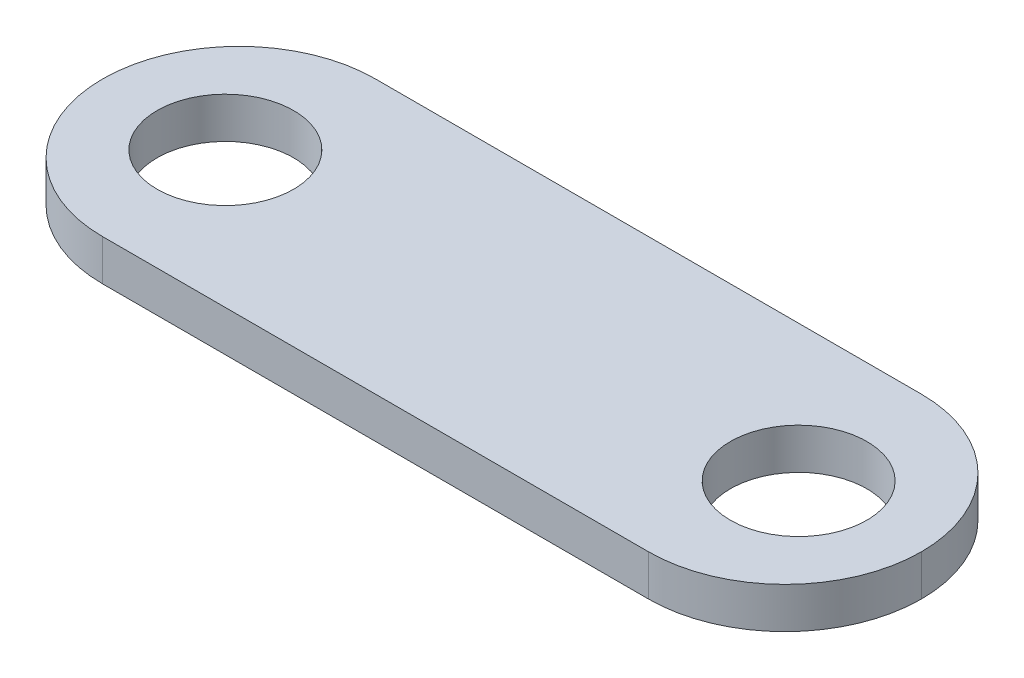
from build123d import *

# Parameters (mm, degrees)
SKETCH2_W           = 60
SKETCH2_H           = 20
BOSS_EXTRUDE1_DEPTH = 3
SKETCH3_R           = 5
CUT_EXTRUDE1_DEPTH  = 64.316664473
SKETCH4_R           = 5
CUT_EXTRUDE2_DEPTH  = 64.316664473
FILLET1_R           = 10
FILLET2_R           = 10


with BuildPart() as part:
    # Sketch2 → Boss-Extrude1 (new body)
    with BuildSketch(Plane(origin=(0, 0, 0), x_dir=(1, 0, 0), z_dir=(0, 1, 0))):
        with Locations((30, 10)):
            Rectangle(SKETCH2_W, SKETCH2_H)
    extrude(amount=BOSS_EXTRUDE1_DEPTH)

    # Sketch3 → Cut-Extrude1 (cut, through all)
    with BuildSketch(Plane(origin=(0, 3, 0), x_dir=(1, 0, 0), z_dir=(0, 1, 0))):
        with Locations(Location((9, 10, 0), (0, 0, 270))):
            Circle(SKETCH3_R)
    extrude(amount=-CUT_EXTRUDE1_DEPTH, mode=Mode.SUBTRACT)

    # Sketch4 → Cut-Extrude2 (cut, through all)
    with BuildSketch(Plane(origin=(0, 3, 0), x_dir=(1, 0, 0), z_dir=(0, 1, 0))):
        with Locations(Location((51, 10, 0), (0, 0, 270))):
            Circle(SKETCH4_R)
    extrude(amount=-CUT_EXTRUDE2_DEPTH, mode=Mode.SUBTRACT)

    # Fillet1
    fillet1_edges = [part.edges().sort_by_distance(p)[0] for p in [
        (0, 1.5, -20),
        (0, 1.5, 0),
    ]]
    fillet(fillet1_edges, radius=FILLET1_R - 0.0001)  # a hair under: the kernel refuses the full size

    # Fillet2
    fillet2_edges = [part.edges().sort_by_distance(p)[0] for p in [
        (60, 1.5, -20),
        (60, 1.5, 0),
    ]]
    fillet(fillet2_edges, radius=FILLET2_R - 0.0001)  # a hair under: the kernel refuses the full size


solid = part.part
